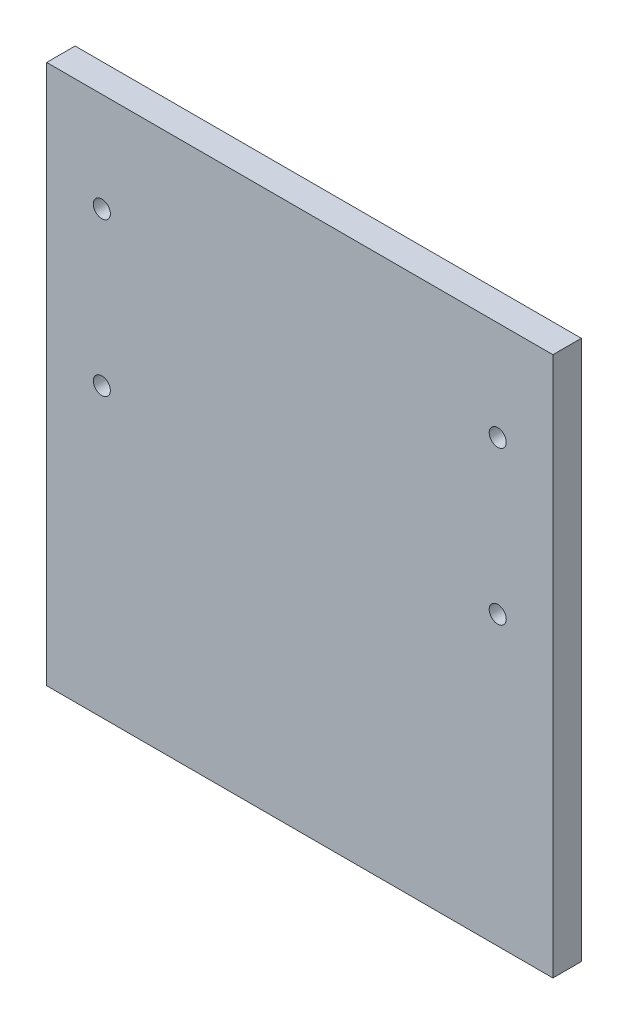
from build123d import *

# Parameters (mm, degrees)
SKETCH1_W           = 89
SKETCH1_H           = 94.9
BOSS_EXTRUDE1_DEPTH = 5
SKETCH2_R           = 1.5
CUT_EXTRUDE1_DEPTH  = 5


with BuildPart() as part:
    # Sketch1 → Boss-Extrude1 (new body)
    with BuildSketch(Plane.XY):
        Rectangle(SKETCH1_W, SKETCH1_H)
    extrude(amount=BOSS_EXTRUDE1_DEPTH)

    # Sketch2 → Cut-Extrude1 (cut)
    with BuildSketch(Plane.XY.offset(5)):
        with Locations((-34.8, 30)):
            Circle(SKETCH2_R)
        with Locations((34.8, 30)):
            Circle(SKETCH2_R)
        with Locations((34.8, 3.08)):
            Circle(SKETCH2_R)
        with Locations((-34.8, 3.08)):
            Circle(SKETCH2_R)
    extrude(amount=-CUT_EXTRUDE1_DEPTH, mode=Mode.SUBTRACT)


solid = part.part
